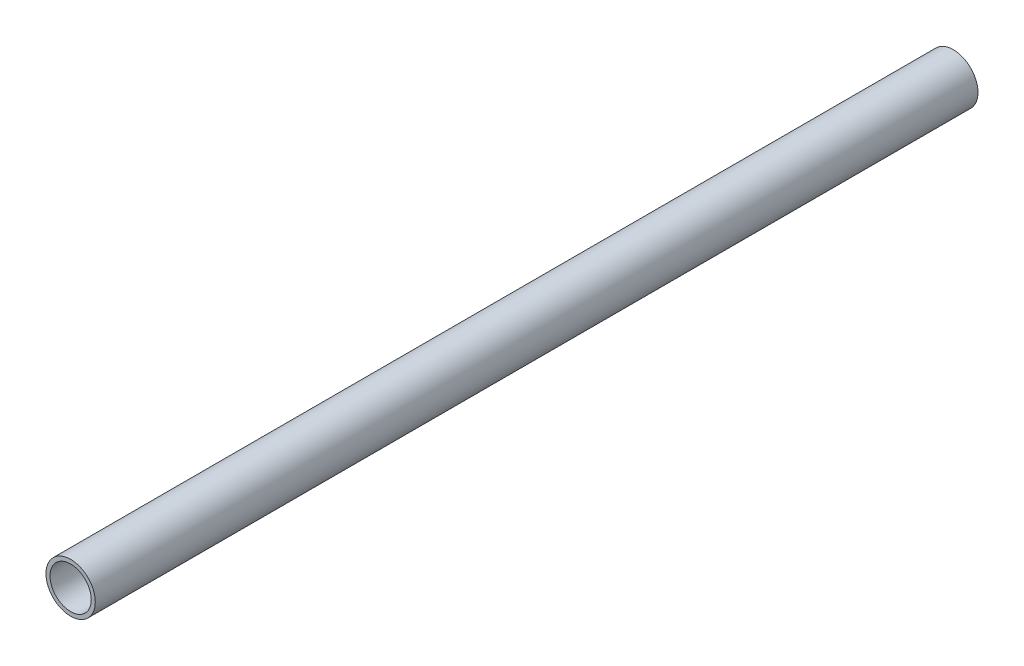
from build123d import *

# Parameters (mm, degrees)
SKETCH1_R           = 24.13
SKETCH1_R_2         = 20.193
BOSS_EXTRUDE1_DEPTH = 863.6


with BuildPart() as part:
    # Sketch1 → Boss-Extrude1 (new body)
    with BuildSketch(Plane.XY):
        Circle(SKETCH1_R)
        Circle(SKETCH1_R_2, mode=Mode.SUBTRACT)
    extrude(amount=BOSS_EXTRUDE1_DEPTH)


solid = part.part
